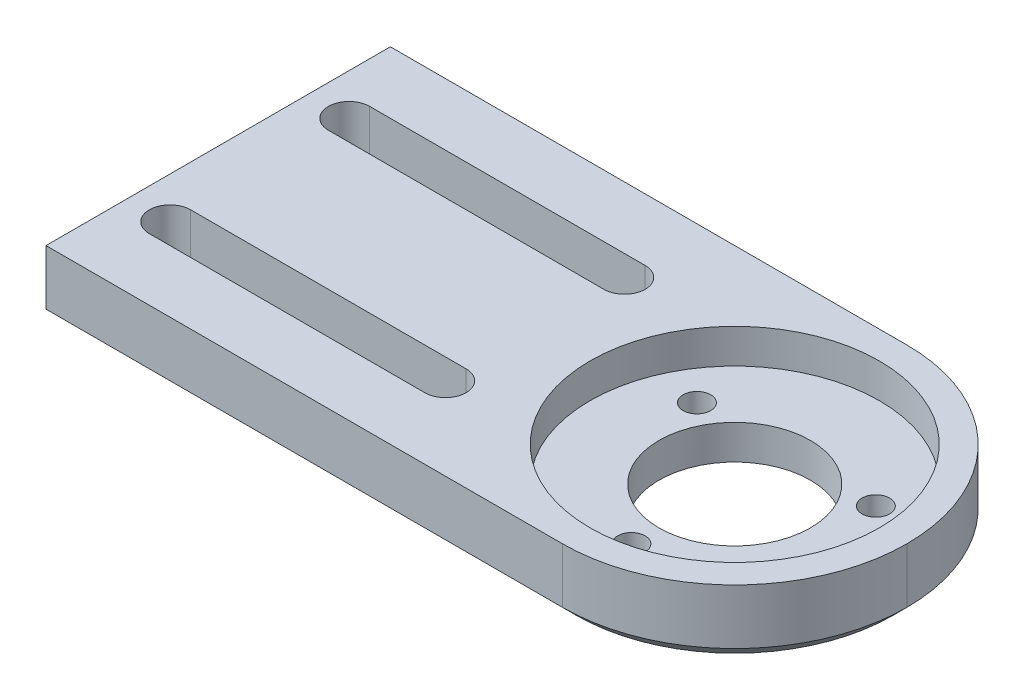
from build123d import *

# Parameters (mm, degrees)
SKETCH1_W               = 100
SKETCH1_H               = 50
BOSS_EXTRUDE1_DEPTH     = 10
FILLET1_R               = 25
CUT_EXTRUDE1_DEPTH      = 113.249721603
CUT_EXTRUDE1_DEPTH_BACK = 113.249721603
SKETCH2_R               = 11
SKETCH2_R_2             = 2
SKETCH3_R               = 21
CUT_EXTRUDE2_DEPTH      = 5
CUT_EXTRUDE3_DEPTH      = 113.249721603
CUT_EXTRUDE3_DEPTH_BACK = 113.249721603
CHAMFER1_SIZE           = 2


with BuildPart() as part:
    # Sketch1 → Boss-Extrude1 (new body)
    with BuildSketch(Plane(origin=(0, 0, 0), x_dir=(1, 0, 0), z_dir=(0, 1, 0))):
        with Locations((50, 25)):
            Rectangle(SKETCH1_W, SKETCH1_H)
    extrude(amount=BOSS_EXTRUDE1_DEPTH)

    # Fillet1
    fillet1_edges = [part.edges().sort_by_distance(p)[0] for p in [
        (100, 5, -50),
        (100, 5, 0),
    ]]
    fillet(fillet1_edges, radius=FILLET1_R - 0.0001)  # a hair under: the kernel refuses the full size

    # Sketch2 → Cut-Extrude1 (cut, two sides: drawn at the far end of the back side and taken through both)
    with BuildSketch(Plane(origin=(0, 0, 0), x_dir=(1, 0, 0), z_dir=(0, 1, 0)).offset(-CUT_EXTRUDE1_DEPTH_BACK)):
        with Locations(Location((75, 25, 0), (0, 0, 90))):
            Circle(SKETCH2_R)
        with Locations(Location((75, 10, 0), (0, 0, 90))):
            Circle(SKETCH2_R_2)
        with Locations(Location((62.009618943, 32.5, 0), (0, 0, 90))):
            Circle(SKETCH2_R_2)
        with Locations(Location((87.990381057, 32.5, 0), (0, 0, 90))):
            Circle(SKETCH2_R_2)
    extrude(amount=CUT_EXTRUDE1_DEPTH + CUT_EXTRUDE1_DEPTH_BACK, mode=Mode.SUBTRACT)

    # Sketch3 → Cut-Extrude2 (cut)
    with BuildSketch(Plane(origin=(0, 10, 0), x_dir=(1, 0, 0), z_dir=(0, 1, 0))):
        with Locations(Location((75, 25, 0), (0, 0, 270))):
            Circle(SKETCH3_R)
    extrude(amount=-CUT_EXTRUDE2_DEPTH, mode=Mode.SUBTRACT)

    # Sketch4 → Cut-Extrude3 (cut, two sides: drawn at the far end of the back side and taken through both)
    with BuildSketch(Plane(origin=(0, 0, 0), x_dir=(1, 0, 0), z_dir=(0, 1, 0)).offset(-CUT_EXTRUDE3_DEPTH_BACK)):
        with BuildLine():
            Line((6, 15), (46, 15))
            ThreePointArc((46, 15), (49, 12), (46, 9))
            Line((46, 9), (6, 9))
            ThreePointArc((6, 9), (3, 12), (6, 15))
        make_face()
        with BuildLine():
            Line((46, 35), (6, 35))
            ThreePointArc((6, 35), (3, 38), (6, 41))
            Line((6, 41), (46, 41))
            ThreePointArc((46, 41), (49, 38), (46, 35))
        make_face()
    extrude(amount=CUT_EXTRUDE3_DEPTH + CUT_EXTRUDE3_DEPTH_BACK, mode=Mode.SUBTRACT)

    # Chamfer1
    chamfer1_edges = [part.edges().sort_by_distance(p)[0] for p in [
        (37.50005, 0, -50),
        (92.677698819, 0, -7.322301181),
        (92.677698819, 0, -42.677698819),
        (37.50005, 0, 0),
        (0, 0, -25),
    ]]
    chamfer(chamfer1_edges, length=CHAMFER1_SIZE)


solid = part.part
